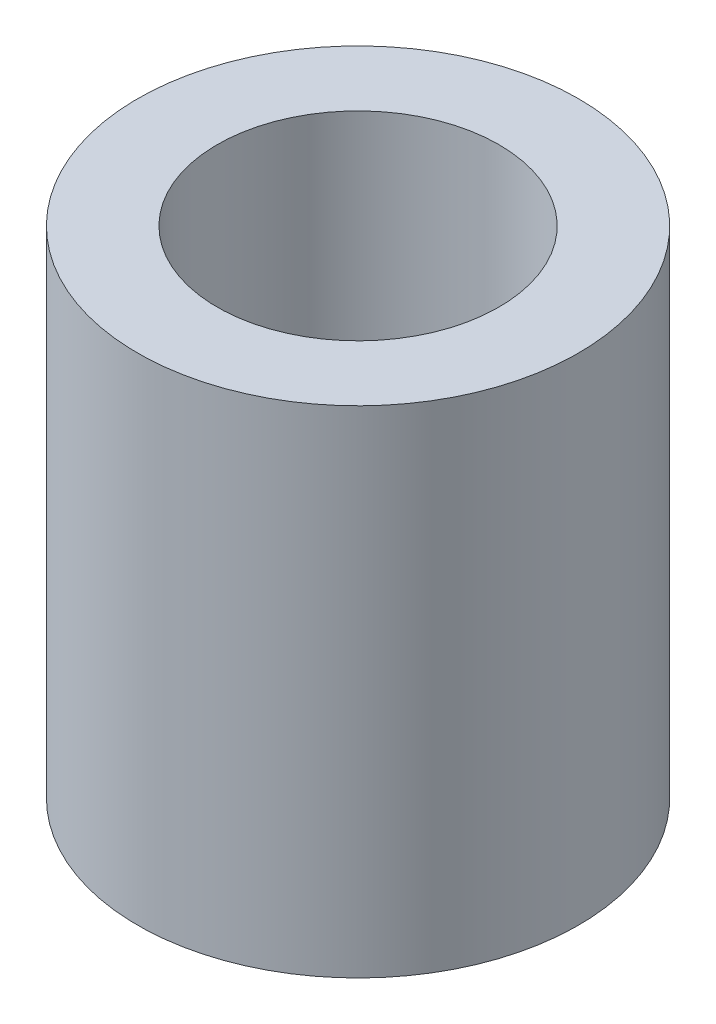
from build123d import *

# Parameters (mm, degrees)
SKETCH1_R           = 17.5
BOSS_EXTRUDE1_DEPTH = 39.348377843
SKETCH2_R           = 11.182486843
CUT_EXTRUDE1_DEPTH  = 47.484350473


with BuildPart() as part:
    # Sketch1 → Boss-Extrude1 (new body)
    with BuildSketch(Plane(origin=(0, 0, 0), x_dir=(1, 0, 0), z_dir=(0, 1, 0))):
        Circle(SKETCH1_R)
    extrude(amount=BOSS_EXTRUDE1_DEPTH)

    # Sketch2 → Cut-Extrude1 (cut, through all)
    with BuildSketch(Plane(origin=(0, 0, 0), x_dir=(1, 0, 0), z_dir=(0, 1, 0))):
        Circle(SKETCH2_R)
    extrude(amount=CUT_EXTRUDE1_DEPTH, mode=Mode.SUBTRACT)


solid = part.part
